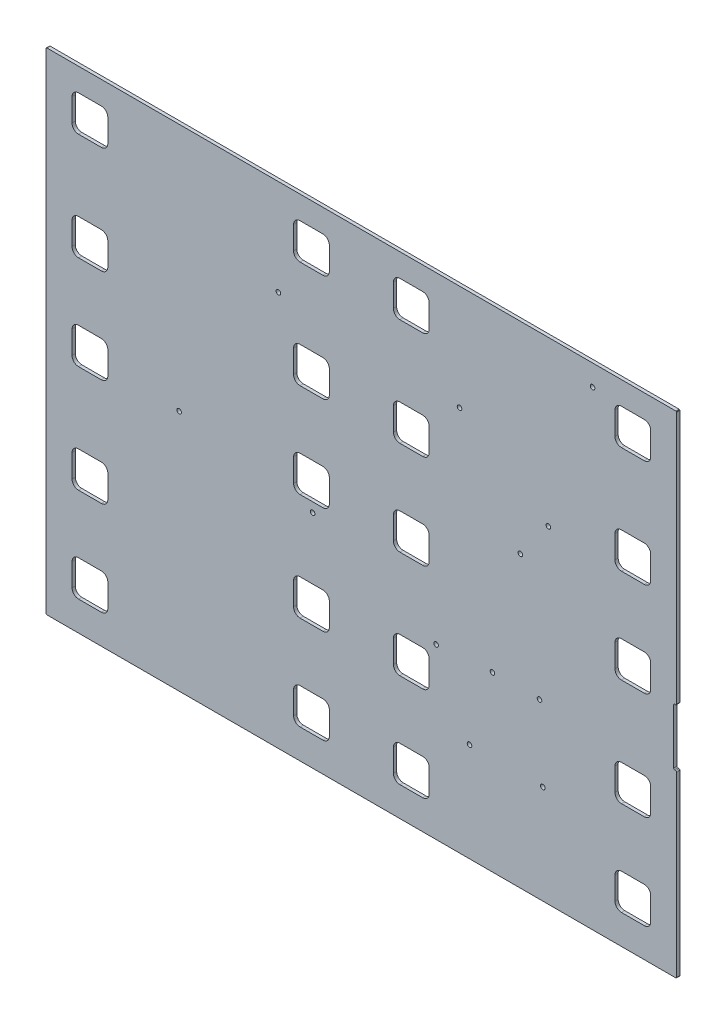
from build123d import *

# Parameters (mm, degrees)
BOSS_EXTRUDE2_DEPTH  = 3.175
CUT_EXTRUDE6_DEPTH   = 569.257427188
LPATTERN2_COUNT      = 2
LPATTERN2_PITCH      = 217.5764
MIRROR1_COPY_1_DEPTH = 569.257427188
CUT_EXTRUDE8_DEPTH   = 569.257427188
M4_CLEARANCE_HOLE1_D = 4.5
FILLET2_R            = 0.79375
FILLET3_R            = 1.016


with BuildPart() as part:
    # Sketch9 → Boss-Extrude2 (new body)
    with BuildSketch(Plane.XY):
        with BuildLine():
            ThreePointArc((475.867292417, 171.345986618), (475.625132776, 171.544437888), (475.426630644, 171.786555837))
            Line((475.426630644, 171.786555837), (-142.918734949, 171.721612037))
            ThreePointArc((-142.918734949, 171.721612037), (-143.117186218, 171.479452396), (-143.359304168, 171.280950264))
            Line((-143.359304168, 171.280950264), (-143.308750051, -310.056816085))
            ThreePointArc((-143.308750051, -310.056816085), (-143.06659041, -310.255267354), (-142.868088278, -310.497385304))
            Line((-142.868088278, -310.497385304), (475.477277315, -310.432441503))
            ThreePointArc((475.477277315, -310.432441503), (475.675728584, -310.190281863), (475.917846534, -309.991779731))
            Line((475.917846534, -309.991779731), (475.867292417, 171.345986618))
        make_face()
    extrude(amount=BOSS_EXTRUDE2_DEPTH)

    # Sketch10 → Cut-Extrude6 (cut, through all)
    with BuildSketch(Plane.XY.offset(3.175)):
        with BuildLine():
            ThreePointArc((-111.536959772, -153.814293782), (-116.026892468, -155.674637302), (-117.886292807, -160.164960677))
            Line((-117.886292807, -160.164960677), (-117.883937231, -182.592960554))
            ThreePointArc((-117.883937231, -182.592960554), (-116.023593711, -187.08289325), (-111.533270336, -188.942293589))
            Line((-111.533270336, -188.942293589), (-89.105270459, -188.939938012))
            ThreePointArc((-89.105270459, -188.939938012), (-84.615337763, -187.079594492), (-82.755937424, -182.589271117))
            Line((-82.755937424, -182.589271117), (-82.758293, -160.161271241))
            ThreePointArc((-82.758293, -160.161271241), (-84.61863652, -155.671338545), (-89.108959895, -153.811938206))
            Line((-89.108959895, -153.811938206), (-111.536959772, -153.814293782))
        make_face()
        with BuildLine():
            ThreePointArc((-111.527235793, -246.397293273), (-116.017168489, -248.257636793), (-117.876568827, -252.747960168))
            Line((-117.876568827, -252.747960168), (-117.874213251, -275.175960044))
            ThreePointArc((-117.874213251, -275.175960044), (-116.013869731, -279.665892741), (-111.523546356, -281.525293079))
            Line((-111.523546356, -281.525293079), (-89.09554648, -281.522937503))
            ThreePointArc((-89.09554648, -281.522937503), (-84.605613784, -279.662593983), (-82.746213445, -275.172270608))
            Line((-82.746213445, -275.172270608), (-82.748569021, -252.744270732))
            ThreePointArc((-82.748569021, -252.744270732), (-84.608912541, -248.254338035), (-89.099235916, -246.394937697))
            Line((-89.099235916, -246.394937697), (-111.527235793, -246.397293273))
        make_face()
        with BuildLine():
            ThreePointArc((-82.769334556, -55.030671822), (-84.629678076, -50.540739126), (-89.120001451, -48.681338787))
            Line((-89.120001451, -48.681338787), (-111.548001328, -48.683694363))
            ThreePointArc((-111.548001328, -48.683694363), (-116.037934024, -50.544037883), (-117.897334363, -55.034361258))
            Line((-117.897334363, -55.034361258), (-117.894978787, -77.462361135))
            ThreePointArc((-117.894978787, -77.462361135), (-116.034635267, -81.952293831), (-111.544311891, -83.81169417))
            Line((-111.544311891, -83.81169417), (-89.116312015, -83.809338593))
            ThreePointArc((-89.116312015, -83.809338593), (-84.626379319, -81.948995073), (-82.76697898, -77.458671698))
            Line((-82.76697898, -77.458671698), (-82.769334556, -55.030671822))
        make_face()
        with BuildLine():
            ThreePointArc((-89.13707755, 113.904260316), (-84.647144854, 115.764603836), (-82.787744515, 120.254927211))
            Line((-82.787744515, 120.254927211), (-82.790100092, 142.682927087))
            ThreePointArc((-82.790100092, 142.682927087), (-84.650443612, 147.172859784), (-89.140766987, 149.032260122))
            Line((-89.140766987, 149.032260122), (-111.568766863, 149.029904546))
            ThreePointArc((-111.568766863, 149.029904546), (-116.058699559, 147.169561026), (-117.918099898, 142.679237651))
            Line((-117.918099898, 142.679237651), (-117.915744322, 120.251237775))
            ThreePointArc((-117.915744322, 120.251237775), (-116.055400802, 115.761305078), (-111.565077427, 113.90190474))
            Line((-111.565077427, 113.90190474), (-89.13707755, 113.904260316))
        make_face()
        with BuildLine():
            ThreePointArc((-117.904702766, 15.120638356), (-116.044359246, 10.630705659), (-111.554035871, 8.771305321))
            Line((-111.554035871, 8.771305321), (-89.126035994, 8.773660897))
            ThreePointArc((-89.126035994, 8.773660897), (-84.636103298, 10.634004417), (-82.77670296, 15.124327792))
            Line((-82.77670296, 15.124327792), (-82.779058536, 37.552327668))
            ThreePointArc((-82.779058536, 37.552327668), (-84.639402056, 42.042260365), (-89.129725431, 43.901660703))
            Line((-89.129725431, 43.901660703), (-111.557725307, 43.899305127))
            ThreePointArc((-111.557725307, 43.899305127), (-116.047658003, 42.038961607), (-117.907058342, 37.548638232))
            Line((-117.907058342, 37.548638232), (-117.904702766, 15.120638356))
        make_face()
    cut_extrude6 = extrude(amount=-CUT_EXTRUDE6_DEPTH, mode=Mode.SUBTRACT)

    # LPattern2: Cut-Extrude6 ×2
    with Locations(*[Vector(0.9999999944845218, 0.00010502836011308041, 0) * (i * LPATTERN2_PITCH) for i in range(1, LPATTERN2_COUNT)]):
        add(cut_extrude6, mode=Mode.SUBTRACT)

    # Mirror1: Cut-Extrude6 across plane
    add(cut_extrude6.mirror(Plane(origin=(166.271985063, 0.017463274, 0), x_dir=(0, 0, 1), z_dir=(-0.9999999944845219, -0.00010502836011320445, 0))), mode=Mode.SUBTRACT)

    # Mirror1 copy 1 sketch → Mirror1 copy 1 (cut, through all)
    with BuildSketch(Plane(origin=(114.967571327, 0.012074856, 3.175), x_dir=(-0.9999999779380877, -0.00021005671906784565, 0), z_dir=(0, 0, 1))):
        with BuildLine():
            ThreePointArc((-111.536959772, 153.814293782), (-116.026892468, 155.674637302), (-117.886292807, 160.164960677))
            Line((-117.886292807, 160.164960677), (-117.883937231, 182.592960554))
            ThreePointArc((-117.883937231, 182.592960554), (-116.023593711, 187.08289325), (-111.533270336, 188.942293589))
            Line((-111.533270336, 188.942293589), (-89.105270459, 188.939938012))
            ThreePointArc((-89.105270459, 188.939938012), (-84.615337763, 187.079594492), (-82.755937424, 182.589271117))
            Line((-82.755937424, 182.589271117), (-82.758293, 160.161271241))
            ThreePointArc((-82.758293, 160.161271241), (-84.61863652, 155.671338545), (-89.108959895, 153.811938206))
            Line((-89.108959895, 153.811938206), (-111.536959772, 153.814293782))
        make_face()
        with BuildLine():
            ThreePointArc((-111.527235793, 246.397293273), (-116.017168489, 248.257636793), (-117.876568827, 252.747960168))
            Line((-117.876568827, 252.747960168), (-117.874213251, 275.175960044))
            ThreePointArc((-117.874213251, 275.175960044), (-116.013869731, 279.665892741), (-111.523546356, 281.525293079))
            Line((-111.523546356, 281.525293079), (-89.09554648, 281.522937503))
            ThreePointArc((-89.09554648, 281.522937503), (-84.605613784, 279.662593983), (-82.746213445, 275.172270608))
            Line((-82.746213445, 275.172270608), (-82.748569021, 252.744270732))
            ThreePointArc((-82.748569021, 252.744270732), (-84.608912541, 248.254338035), (-89.099235916, 246.394937697))
            Line((-89.099235916, 246.394937697), (-111.527235793, 246.397293273))
        make_face()
        with BuildLine():
            ThreePointArc((-82.769334556, 55.030671822), (-84.629678076, 50.540739126), (-89.120001451, 48.681338787))
            Line((-89.120001451, 48.681338787), (-111.548001328, 48.683694363))
            ThreePointArc((-111.548001328, 48.683694363), (-116.037934024, 50.544037883), (-117.897334363, 55.034361258))
            Line((-117.897334363, 55.034361258), (-117.894978787, 77.462361135))
            ThreePointArc((-117.894978787, 77.462361135), (-116.034635267, 81.952293831), (-111.544311891, 83.81169417))
            Line((-111.544311891, 83.81169417), (-89.116312015, 83.809338593))
            ThreePointArc((-89.116312015, 83.809338593), (-84.626379319, 81.948995073), (-82.76697898, 77.458671698))
            Line((-82.76697898, 77.458671698), (-82.769334556, 55.030671822))
        make_face()
        with BuildLine():
            ThreePointArc((-89.13707755, -113.904260316), (-84.647144854, -115.764603836), (-82.787744515, -120.254927211))
            Line((-82.787744515, -120.254927211), (-82.790100092, -142.682927087))
            ThreePointArc((-82.790100092, -142.682927087), (-84.650443612, -147.172859784), (-89.140766987, -149.032260122))
            Line((-89.140766987, -149.032260122), (-111.568766863, -149.029904546))
            ThreePointArc((-111.568766863, -149.029904546), (-116.058699559, -147.169561026), (-117.918099898, -142.679237651))
            Line((-117.918099898, -142.679237651), (-117.915744322, -120.251237775))
            ThreePointArc((-117.915744322, -120.251237775), (-116.055400802, -115.761305078), (-111.565077427, -113.90190474))
            Line((-111.565077427, -113.90190474), (-89.13707755, -113.904260316))
        make_face()
        with BuildLine():
            ThreePointArc((-117.904702766, -15.120638356), (-116.044359246, -10.630705659), (-111.554035871, -8.771305321))
            Line((-111.554035871, -8.771305321), (-89.126035994, -8.773660897))
            ThreePointArc((-89.126035994, -8.773660897), (-84.636103298, -10.634004417), (-82.77670296, -15.124327792))
            Line((-82.77670296, -15.124327792), (-82.779058536, -37.552327668))
            ThreePointArc((-82.779058536, -37.552327668), (-84.639402056, -42.042260365), (-89.129725431, -43.901660703))
            Line((-89.129725431, -43.901660703), (-111.557725307, -43.899305127))
            ThreePointArc((-111.557725307, -43.899305127), (-116.047658003, -42.038961607), (-117.907058342, -37.548638232))
            Line((-117.907058342, -37.548638232), (-117.904702766, -15.120638356))
        make_face()
    extrude(amount=-MIRROR1_COPY_1_DEPTH, mode=Mode.SUBTRACT)

    # Sketch12 → Cut-Extrude8 (cut, through all)
    with BuildSketch(Plane.XY.offset(3.175)):
        Polygon((475.893497013, -78.154204664), (472.960931489, -78.154204664), (472.960931489, -106.094205545), (472.960931489, -134.034204664), (475.899365998, -134.034204664), align=None)
    extrude(amount=-CUT_EXTRUDE8_DEPTH, mode=Mode.SUBTRACT)

    # M4 Clearance Hole1 (through all)
    with Locations(Plane.XY.offset(3.175)):
        with Locations((-12.721209804, -72.402214877), (118.390061764, -93.071344589), (272.495194366, -213.341259843), (344.495193969, -213.333697801), (239.680463229, -144.493605941), (295.022553428, -140.58889343), (341.222553174, -140.58404112), (322.427523958, -26.052005233), (349.923624736, 11.074864309), (262.675609611, 68.341710375), (393.319414118, 151.140432137), (84.813035404, 77.608029812)):
            Hole(M4_CLEARANCE_HOLE1_D / 2)

    # Fillet2
    fillet2_edges = [part.edges().sort_by_distance(p)[0] for p in [
        (-142.868088278, -310.497385304, 1.5875),
        (-143.308750051, -310.056816085, 1.5875),
        (475.477277315, -310.432441503, 1.5875),
        (475.917846534, -309.991779731, 1.5875),
        (475.867292417, 171.345986618, 1.5875),
        (475.426630644, 171.786555837, 1.5875),
        (-142.918734949, 171.721612037, 1.5875),
        (-143.359304168, 171.280950264, 1.5875),
    ]]
    fillet(fillet2_edges, radius=FILLET2_R)

    # Fillet3
    fillet3_edges = [part.edges().sort_by_distance(p)[0] for p in [
        (475.893497013, -78.154204664, 1.5875),
        (472.960931489, -78.154204664, 1.5875),
        (475.899365998, -134.034204664, 1.5875),
        (472.960931489, -134.034204664, 1.5875),
    ]]
    fillet(fillet3_edges, radius=FILLET3_R)


solid = part.part
